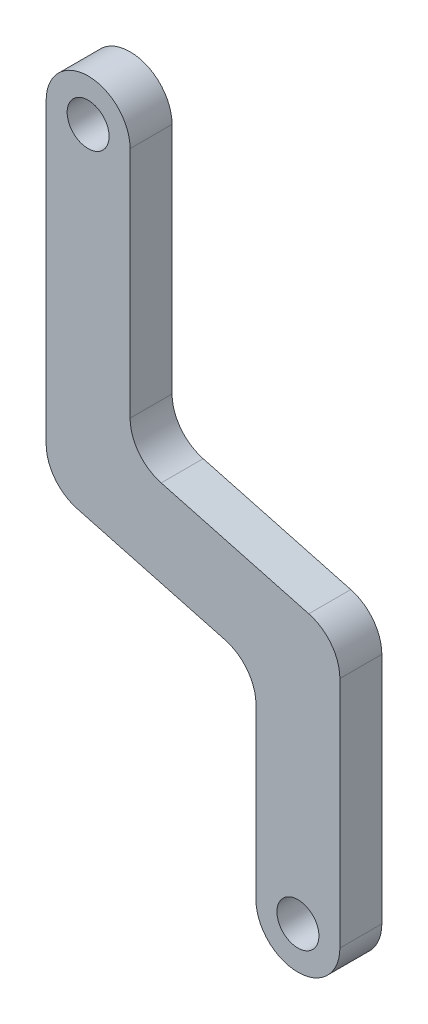
from build123d import *

# Parameters (mm, degrees)
SKETCH1_R           = 5
SKETCH1_R_2         = 2.5
BOSS_EXTRUDE1_DEPTH = 5
FILLET1_R           = 5


with BuildPart() as part:
    # Sketch1 → Boss-Extrude1 (new body)
    # profile 1 of 3: a face of its own
    with BuildSketch(Plane.XY):
        with BuildLine():
            Line((-7.5, 3.349364905), (-7.5, 35))
            ThreePointArc((-7.5, 35), (-12.5, 30), (-17.5, 35))
            Line((-17.5, 35), (-17.5, -4.323904974))
            Line((-17.5, -4.323904974), (7.5, -11.022634785))
            Line((7.5, -11.022634785), (7.5, -35))
            ThreePointArc((7.5, -35), (12.5, -30), (17.5, -35))
            Line((17.5, -35), (17.5, -3.349364905))
            Line((17.5, -3.349364905), (-7.5, 3.349364905))
        make_face()
    # profile 2 of 3: a face of its own
    with BuildSketch(Plane.XY):
        with Locations((-12.5, 35)):
            Circle(SKETCH1_R)
        with Locations((-12.5, 35)):
            Circle(SKETCH1_R_2, mode=Mode.SUBTRACT)
    # profile 3 of 3: a face of its own
    with BuildSketch(Plane.XY):
        with Locations((12.5, -35)):
            Circle(SKETCH1_R)
        with Locations((12.5, -35)):
            Circle(SKETCH1_R_2, mode=Mode.SUBTRACT)
    extrude(amount=BOSS_EXTRUDE1_DEPTH)

    # Fillet1
    fillet1_edges = [part.edges().sort_by_distance(p)[0] for p in [
        (-7.5, 3.349364905, 2.5),
        (17.5, -3.349364905, 2.5),
        (7.5, -11.022634785, 2.5),
        (-17.5, -4.323904974, 2.5),
    ]]
    fillet(fillet1_edges, radius=FILLET1_R)


solid = part.part
